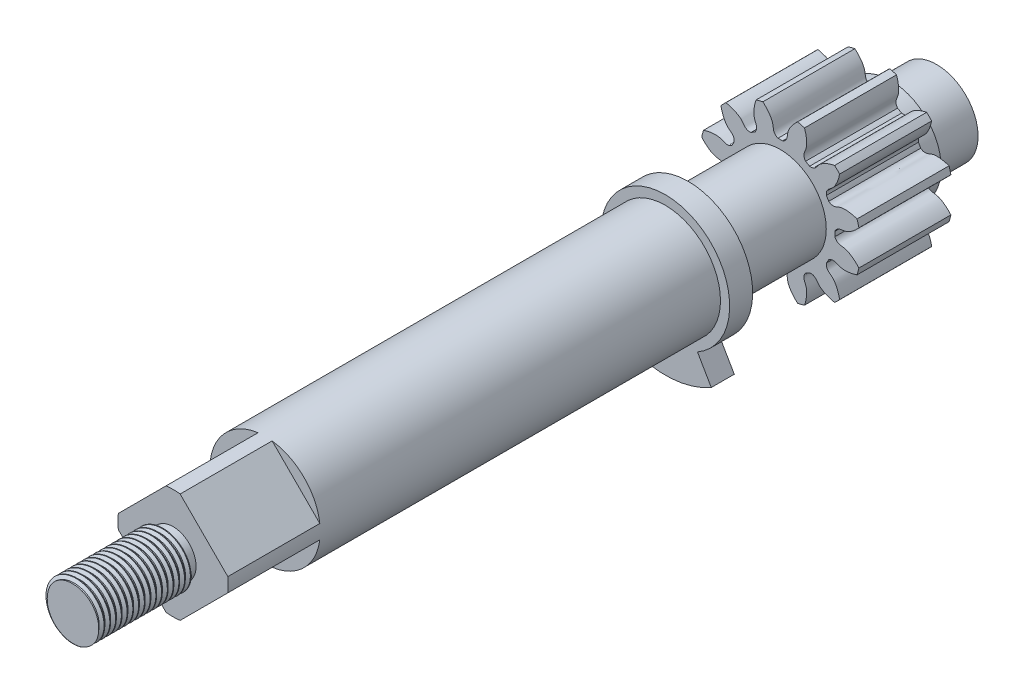
from build123d import *

# Parameters (mm, degrees)
SKETCH_1_R               = 17.5
EXTRUDE_1_DEPTH          = 20
CUT_EXTRUDE_1_DEPTH      = 32.819805153
PATTERN_CIRCULAR_1_COUNT = 12
SKETCH_5_R               = 11
EXTRUDE_2_DEPTH          = 4
SKETCH_6_R               = 9
EXTRUDE_3_DEPTH          = 10
SKETCH_7_R               = 10
EXTRUDE_4_DEPTH          = 20
SKETCH_8_R               = 14
SKETCH_8_R_2             = 10
EXTRUDE_5_DEPTH          = 5
SKETCH_9_R               = 12
EXTRUDE_6_DEPTH          = 87
SKETCH_10_R              = 12
EXTRUDE_7_DEPTH          = 20
CUT_EXTRUDE_START        = -20
CUT_EXTRUDE_4_DEPTH      = 20
SKETCH_12_R              = 5
EXTRUDE_8_DEPTH          = 2
SKETCH_13_R              = 6
EXTRUDE_9_DEPTH          = 20
THREAD_1_PITCH           = 1.25


with BuildPart() as part:
    # Sketch 1 → 凸台-拉伸1 (new body)
    with BuildSketch(Plane.XY):
        Circle(SKETCH_1_R)
    extrude(amount=EXTRUDE_1_DEPTH)

    # 草图2 → 切除-拉伸1 (cut, through all)
    with BuildSketch(Plane.XY):
        with BuildLine():
            ThreePointArc((0.502100282, 11.864380317), (0, 11.875), (-0.502100282, 11.864380317))
            add(Edge.make_bspline(
                [(-0.502100282, 11.864380317), (-1.701972173, 12.373268657), (-1.435933697, 13.362046706), (-1.69038047, 14.223701444), (-1.706559635, 14.274764343), (-1.725568126, 14.330833563), (-1.747607172, 14.391815219), (-1.772881563, 14.457608097), (-1.80159129, 14.528105172), (-1.833933902, 14.60319324), (-1.870103578, 14.68275313), (-1.910291193, 14.766659749), (-1.954684094, 14.854782178), (-2.003465963, 14.946983765), (-2.056816658, 15.043122218), (-2.114912061, 15.143049702), (-2.177923928, 15.246612946), (-2.246019746, 15.353653348), (-2.319362586, 15.464007084), (-2.398110961, 15.577505223), (-2.482418689, 15.693973844), (-2.57243476, 15.813234161), (-2.668303195, 15.935102639), (-2.770162926, 16.059391129), (-2.878147664, 16.185906997), (-2.992385776, 16.314453257), (-3.113000167, 16.444828709), (-3.240108162, 16.57682808), (-3.373821394, 16.710242168), (-3.514245693, 16.844857984), (-3.66148098, 16.980458907), (-3.815621167, 17.116824833), (-3.976754053, 17.253732327), (-4.144961237, 17.390954784), (-4.32031802, 17.528262588), (-4.502893319, 17.665423268), (-4.692749589, 17.802201671), (-4.889942736, 17.93836012), (-5.094522049, 18.073658589), (-5.306530125, 18.207854867), (-5.526002801, 18.340704735), (-5.752969097, 18.471962138), (-5.987451153, 18.601379359), (-6.229464173, 18.7287072), (-6.479016384, 18.853695156), (-6.736108982, 18.9760916), (-7.000736093, 19.095643961), (-7.27288474, 19.212098905), (-7.552534816, 19.325202523), (-7.839659012, 19.434700516), (-8.235949264, 19.576819897), (-8.538984, 19.67525352), (-8.744013506, 19.737427276)],
                knots=[0, 0, 0, 0, 0.218015236, 0.222043642, 0.226545979, 0.231522246, 0.236972443, 0.24289657, 0.249294627, 0.256166614, 0.263512532, 0.271332379, 0.279626157, 0.288393865, 0.297635503, 0.307351072, 0.31754057, 0.328203999, 0.339341357, 0.350952646, 0.363037866, 0.375597015, 0.388630094, 0.402137104, 0.416118043, 0.430572913, 0.445501713, 0.460904444, 0.476781104, 0.493131694, 0.509956215, 0.527254666, 0.545027047, 0.563273358, 0.581993599, 0.601187771, 0.620855872, 0.640997904, 0.661613866, 0.682703758, 0.704267581, 0.726305333, 0.748817015, 0.771802628, 0.795262171, 0.819195644, 0.843603047, 0.868484381, 0.893839644, 0.919668838, 0.945971962, 1, 1, 1, 1], degree=3))
            ThreePointArc((-8.744013506, 19.737427276), (0, 21.587584572), (8.744013506, 19.737427276))
            add(Edge.make_bspline(
                [(0.502100282, 11.864380317), (1.701972173, 12.373268657), (1.435933697, 13.362046706), (1.69038047, 14.223701444), (1.706559635, 14.274764343), (1.725568126, 14.330833563), (1.747607172, 14.391815219), (1.772881563, 14.457608097), (1.80159129, 14.528105172), (1.833933902, 14.60319324), (1.870103578, 14.68275313), (1.910291193, 14.766659749), (1.954684094, 14.854782178), (2.003465963, 14.946983765), (2.056816658, 15.043122218), (2.114912061, 15.143049702), (2.177923928, 15.246612946), (2.246019746, 15.353653348), (2.319362586, 15.464007084), (2.398110961, 15.577505223), (2.482418689, 15.693973844), (2.57243476, 15.813234161), (2.668303195, 15.935102639), (2.770162926, 16.059391129), (2.878147664, 16.185906997), (2.992385776, 16.314453257), (3.113000167, 16.444828709), (3.240108162, 16.57682808), (3.373821394, 16.710242168), (3.514245693, 16.844857984), (3.66148098, 16.980458907), (3.815621167, 17.116824833), (3.976754053, 17.253732327), (4.144961237, 17.390954784), (4.32031802, 17.528262588), (4.502893319, 17.665423268), (4.692749589, 17.802201671), (4.889942736, 17.93836012), (5.094522049, 18.073658589), (5.306530125, 18.207854867), (5.526002801, 18.340704735), (5.752969097, 18.471962138), (5.987451153, 18.601379359), (6.229464173, 18.7287072), (6.479016384, 18.853695156), (6.736108982, 18.9760916), (7.000736093, 19.095643961), (7.27288474, 19.212098905), (7.552534816, 19.325202523), (7.839659012, 19.434700516), (8.235949264, 19.576819897), (8.538984, 19.67525352), (8.744013506, 19.737427276)],
                knots=[0, 0, 0, 0, 0.218015236, 0.222043642, 0.226545979, 0.231522246, 0.236972443, 0.24289657, 0.249294627, 0.256166614, 0.263512532, 0.271332379, 0.279626157, 0.288393865, 0.297635503, 0.307351072, 0.31754057, 0.328203999, 0.339341357, 0.350952646, 0.363037866, 0.375597015, 0.388630094, 0.402137104, 0.416118043, 0.430572913, 0.445501713, 0.460904444, 0.476781104, 0.493131694, 0.509956215, 0.527254666, 0.545027047, 0.563273358, 0.581993599, 0.601187771, 0.620855872, 0.640997904, 0.661613866, 0.682703758, 0.704267581, 0.726305333, 0.748817015, 0.771802628, 0.795262171, 0.819195644, 0.843603047, 0.868484381, 0.893839644, 0.919668838, 0.945971962, 1, 1, 1, 1], degree=3))
        make_face()
    cut_extrude_1 = extrude(amount=CUT_EXTRUDE_1_DEPTH, mode=Mode.SUBTRACT)

    # 阵列(圆周)1: 切除-拉伸1 ×12 about axis
    pattern_circular_1_axis = Axis((0, 0, -1), (0, 0, 1))
    for i in range(1, PATTERN_CIRCULAR_1_COUNT):
        add(cut_extrude_1.rotate(pattern_circular_1_axis, i * 360 / PATTERN_CIRCULAR_1_COUNT), mode=Mode.SUBTRACT)

    # 草图5 → 凸台-拉伸2 (add)
    with BuildSketch(Plane(origin=(0, 0, 0), x_dir=(-1, 0, 0), z_dir=(0, 0, -1))):
        with Locations(Location((0, 0, 0), (0, 0, 180))):
            Circle(SKETCH_5_R)
    extrude(amount=EXTRUDE_2_DEPTH)

    # 草图6 → 凸台-拉伸3 (add)
    with BuildSketch(Plane(origin=(0, 0, -4), x_dir=(-1, 0, 0), z_dir=(0, 0, -1))):
        Circle(SKETCH_6_R)
    extrude(amount=EXTRUDE_3_DEPTH)

    # 草图7 → 凸台-拉伸4 (add)
    with BuildSketch(Plane.XY.offset(20)):
        Circle(SKETCH_7_R)
    extrude(amount=EXTRUDE_4_DEPTH)

    # 草图8 → 凸台-拉伸5 (add)
    # profile 1 of 3: a face of its own
    with BuildSketch(Plane.XY.offset(40)):
        Circle(SKETCH_8_R)
        Circle(SKETCH_8_R_2, mode=Mode.SUBTRACT)
    # profile 2 of 3: a face of its own
    with BuildSketch(Plane.XY.offset(40)):
        Circle(SKETCH_8_R_2)
    # profile 3 of 3: a face of its own
    with BuildSketch(Plane.XY.offset(40)):
        with BuildLine():
            Line((10, -17.320508076), (7, -12.124355653))
            ThreePointArc((7, -12.124355653), (0, -14), (-7, -12.124355653))
            Line((-7, -12.124355653), (-10, -17.320508076))
            ThreePointArc((-10, -17.320508076), (0, -20), (10, -17.320508076))
        make_face()
    extrude(amount=EXTRUDE_5_DEPTH)

    # 草图9 → 凸台-拉伸6 (add)
    with BuildSketch(Plane.XY.offset(45)):
        Circle(SKETCH_9_R)
    extrude(amount=EXTRUDE_6_DEPTH)

    # 草图10 → 凸台-拉伸7 (add)
    with BuildSketch(Plane.XY.offset(132)):
        Circle(SKETCH_10_R)
    extrude(amount=EXTRUDE_7_DEPTH)

    # 草图11 → 切除-拉伸4 (cut)
    with BuildSketch(Plane.XY.offset(152).offset(CUT_EXTRUDE_START)):
        with BuildLine():
            ThreePointArc((11.90162476, 1.533404083), (8.485281374, 8.485281374), (1.533404083, 11.90162476))
            Line((1.533404083, 11.90162476), (11.90162476, 1.533404083))
        make_face()
        with BuildLine():
            Line((-11.90162476, 1.533404083), (-1.533404083, 11.90162476))
            ThreePointArc((-1.533404083, 11.90162476), (-8.485281374, 8.485281374), (-11.90162476, 1.533404083))
        make_face()
        with BuildLine():
            ThreePointArc((1.533404083, -11.90162476), (8.485281374, -8.485281374), (11.90162476, -1.533404083))
            Line((11.90162476, -1.533404083), (1.533404083, -11.90162476))
        make_face()
        with BuildLine():
            Line((-1.533404083, -11.90162476), (-11.90162476, -1.533404083))
            ThreePointArc((-11.90162476, -1.533404083), (-8.485281374, -8.485281374), (-1.533404083, -11.90162476))
        make_face()
    extrude(amount=CUT_EXTRUDE_4_DEPTH, mode=Mode.SUBTRACT)

    # 草图12 → 凸台-拉伸8 (add)
    with BuildSketch(Plane.XY.offset(152)):
        Circle(SKETCH_12_R)
    extrude(amount=EXTRUDE_8_DEPTH)

    # 草图13 → 凸台-拉伸9 (add)
    with BuildSketch(Plane.XY.offset(154)):
        Circle(SKETCH_13_R)
    extrude(amount=EXTRUDE_9_DEPTH)

    # 螺纹线1: the profile of Sketch 1 2 profile screwed along a right-hand helix of 16.8 turns, 8 arcs to a turn; built about Z, then put on its axis
    thread_1_z = Axis((0, 0, 0), (0, 0, 1))
    thread_1_corners = [(6.0003, 0, -0.000173205), (6.0003, 0, 1.093923202), (5.323417656, 0, 0.703124998), (5.323417656, 0, 0.390624998)]
    with BuildLine(mode=Mode.PRIVATE) as thread_1_profile:
        Line(thread_1_corners[0], thread_1_corners[1])
        Line(thread_1_corners[1], thread_1_corners[2])
        Line(thread_1_corners[2], thread_1_corners[3])
        Line(thread_1_corners[3], thread_1_corners[0])
    thread_1_cap = Face(thread_1_profile.wire())
    thread_1_turn_angles = [0, 22.5, 45, 67.5, 90, 112.5, 135, 157.5, 180, 202.5, 225, 247.5, 270, 292.5, 315, 337.5, 360]
    thread_1_turn_weights = [1, 0.9238795325112867, 1, 0.9238795325112867, 1, 0.9238795325112867, 1, 0.9238795325112867, 1, 0.9238795325112867, 1, 0.9238795325112867, 1, 0.9238795325112867, 1, 0.9238795325112867, 1]
    thread_1_turn_rails = [Edge.make_bspline([Vector(p[0], p[1], 0).rotate(thread_1_z, thread_1_turn_angles[k]) / thread_1_turn_weights[k] + Vector(0, 0, p[2] + THREAD_1_PITCH * thread_1_turn_angles[k] / 360) for k in range(17)], [0, 0, 0, 1, 1, 2, 2, 3, 3, 4, 4, 5, 5, 6, 6, 7, 7, 8, 8, 8], 2, thread_1_turn_weights) for p in thread_1_corners]
    thread_1_turn_sides = [Face.make_surface_from_curves(thread_1_turn_rails[p[0]], thread_1_turn_rails[p[1]]) for p in [(0, 1), (1, 2), (2, 3), (3, 0)]]
    thread_1_last_angles = [5760, 5782.5, 5805, 5827.5, 5850, 5872.5, 5895, 5917.5, 5940, 5962.5, 5985, 6007.5, 6030, 6039, 6048]
    thread_1_last_weights = [1, 0.9238795325112867, 1, 0.9238795325112867, 1, 0.9238795325112867, 1, 0.9238795325112867, 1, 0.9238795325112867, 1, 0.9238795325112867, 1, 0.9876883405951414, 1]
    thread_1_last_rails = [Edge.make_bspline([Vector(p[0], p[1], 0).rotate(thread_1_z, thread_1_last_angles[k]) / thread_1_last_weights[k] + Vector(0, 0, p[2] + THREAD_1_PITCH * thread_1_last_angles[k] / 360) for k in range(15)], [0, 0, 0, 1, 1, 2, 2, 3, 3, 4, 4, 5, 5, 6, 6, 7, 7, 7], 2, thread_1_last_weights) for p in thread_1_corners]
    thread_1_last_sides = [Face.make_surface_from_curves(thread_1_last_rails[p[0]], thread_1_last_rails[p[1]]) for p in [(0, 1), (1, 2), (2, 3), (3, 0)]]
    thread_1 = Plane(origin=(0, 0, 153), x_dir=(1, 0, 0), z_dir=(0, 0, 1)) * Solid(Shell([*[p.moved(Location((0, 0, THREAD_1_PITCH * i))) for i in range(16) for p in thread_1_turn_sides], *thread_1_last_sides, thread_1_cap, thread_1_cap.rotate(thread_1_z, 6048).moved(Location((0, 0, THREAD_1_PITCH * 6048 / 360)))]))
    add(thread_1, mode=Mode.SUBTRACT)


solid = part.part
